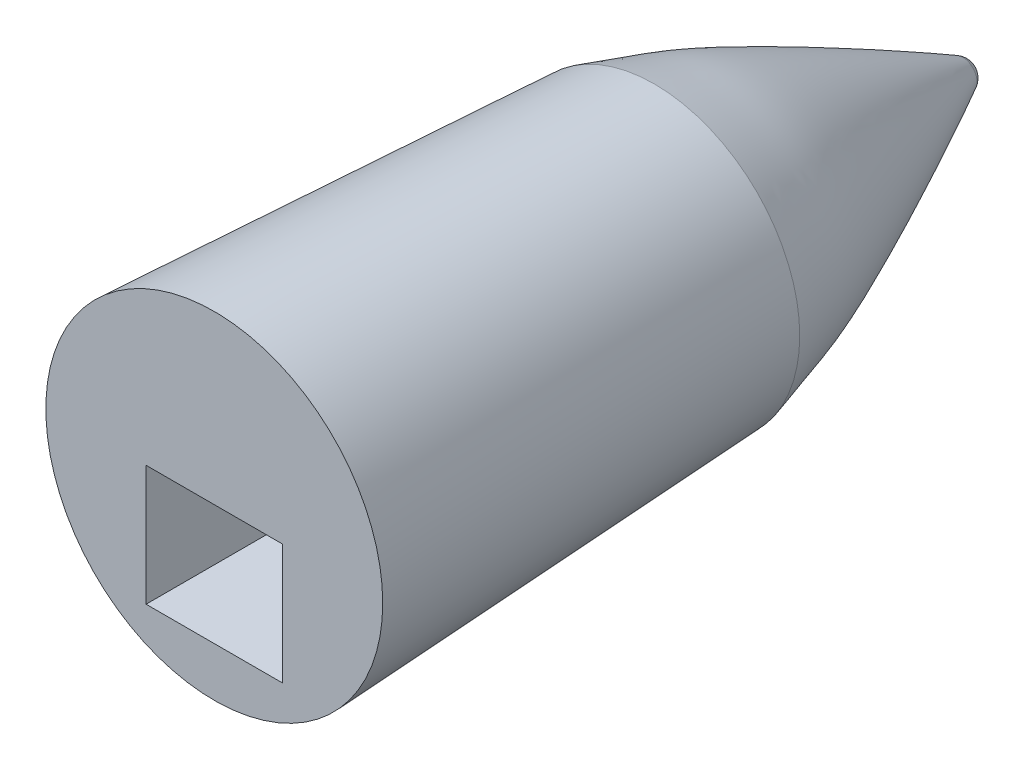
from build123d import *

# Parameters (mm, degrees)
SKETCH_4_W          = 17
SKETCH_4_H          = 15
CUT_EXTRUDE_1_DEPTH = 30
SKETCH_5_W          = 17
SKETCH_5_H          = 12
CUT_EXTRUDE_2_DEPTH = 25


with BuildPart() as part:
    # Эскиз1 → Повернуть1 (revolve)
    with BuildSketch(Plane(origin=(0, 0, 0), x_dir=(1, 0, 0), z_dir=(0, 1, 0))):
        with BuildLine():
            Line((-21, -20), (0, -20))
            Line((0, -20), (0, 76.509456591))
            add(Edge.make_bspline(
                [(-21, 23.303526799), (-20.950151988, 23.55619715), (-20.588242456, 25.356689417), (-19.861805291, 28.542980585), (-18.781007648, 32.618309393), (-17.683803917, 36.387694686), (-16.794111183, 39.324775715), (-16.139995318, 41.546015667), (-15.635538449, 43.197589032), (-15.024163935, 45.012380328), (-13.937228163, 47.886209516), (-11.955046686, 52.531179902), (-8.996626021, 58.945239937), (-6.340494309, 64.415530495), (-4.283171781, 68.509695264), (-2.81904039, 71.351111958), (-1.479938004, 73.873249362), (-0.567336195, 75.524317414), (-0.112134261, 76.316693352), (0, 76.509456591)],
                knots=[0.246223276, 0.246223276, 0.246223276, 0.246223276, 0.255865129, 0.31540599, 0.374946852, 0.434487714, 0.494028576, 0.523799007, 0.553569438, 0.583339868, 0.613110299, 0.672651161, 0.732192023, 0.791732885, 0.821503316, 0.851273747, 0.881044177, 0.910814608, 0.921120543, 0.921120543, 0.921120543, 0.921120543], degree=3))
            Line((-21, 23.303526799), (-21, -20))
        make_face()
    revolve(axis=Axis((0, 0, -76.509456591), (0, 0, 1)))

    # Эскиз2 → Вырез-Повернуть1 (revolve, cut)
    with BuildSketch(Plane(origin=(0, 0, 0), x_dir=(1, 0, 0), z_dir=(0, 1, 0))):
        Polygon((21, -20), (21, 66.971973821), (16.441991992, 66.971973821), align=None)
    revolve(axis=Axis((0, 0, 20), (0, 0, -1)), mode=Mode.SUBTRACT)

    # Эскиз3 → Вырез-Повернуть2 (revolve, cut)
    with BuildSketch(Plane(origin=(0, 0, 0), x_dir=(1, 0, 0), z_dir=(0, 1, 0))):
        with BuildLine():
            Line((1e-08, 76.509474859), (1e-08, 74.388246536))
            ThreePointArc((1e-08, 74.388246536), (1.026734817, 74.10458439), (1.762223825, 73.334062167))
            Line((1.762223825, 73.334062167), (4.025925166, 73.334062167))
            Line((4.025925166, 73.334062167), (4.025925166, 76.509474859))
            Line((4.025925166, 76.509474859), (1e-08, 76.509474859))
        make_face()
    revolve(axis=Axis((1e-08, 0, -76.509474859), (0, 0, 1)), mode=Mode.SUBTRACT)

    # Эскиз4 → Вырез-Вытянуть1 (cut)
    with BuildSketch(Plane.XY.offset(20)):
        with Locations((0, -7.363542794)):
            Rectangle(SKETCH_4_W, SKETCH_4_H)
    extrude(amount=-CUT_EXTRUDE_1_DEPTH, mode=Mode.SUBTRACT)

    # Эскиз5 → Вырез-Вытянуть2 (cut)
    with BuildSketch(Plane(origin=(0, -14.863542794, 0), x_dir=(1, 0, 0), z_dir=(0, 1, 0))):
        with Locations((0, 4)):
            Rectangle(SKETCH_5_W, SKETCH_5_H)
    extrude(amount=CUT_EXTRUDE_2_DEPTH, mode=Mode.SUBTRACT)


solid = part.part
